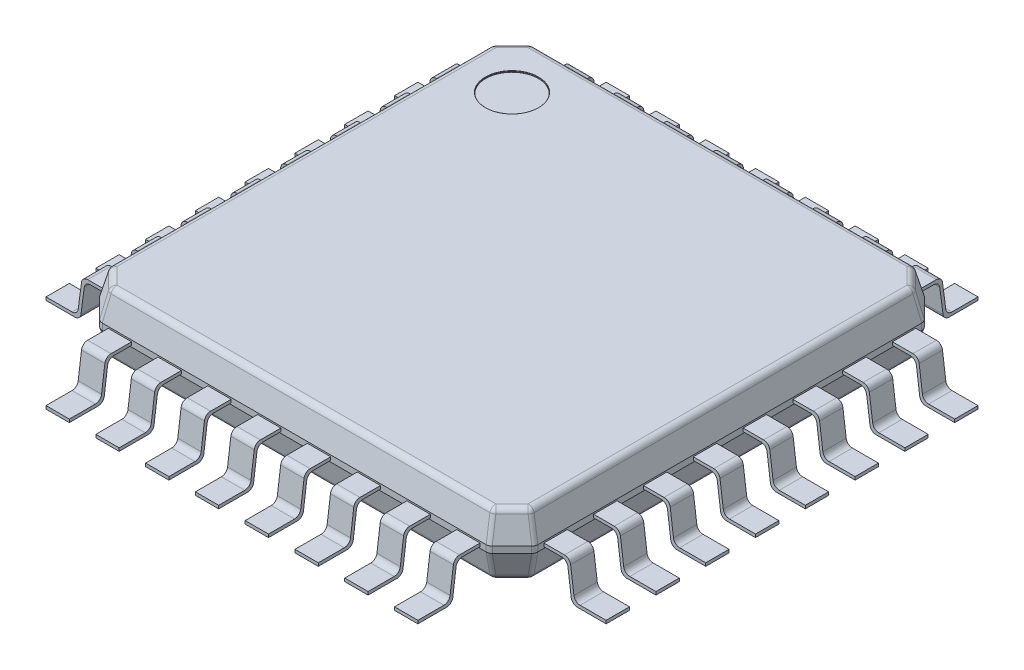
from build123d import *
from OCP.BRepFilletAPI import BRepFilletAPI_MakeChamfer

# Parameters (mm, degrees)
BOSS_EXTRUDE1_START  = 0.1
SKETCH1_W            = 7
SKETCH1_H            = 7
BOSS_EXTRUDE1_DEPTH  = 1
BOSS_EXTRUDE2_START  = -0.5125
BOSS_EXTRUDE2_DEPTH  = 0.375
LPATTERN1_COUNT      = 8
LPATTERN1_PITCH      = 0.8
CIRPATTERN2_START    = -2.9875
CIRPATTERN2_DEPTH    = 0.375
CIRPATTERN2_START_2  = -2.1875
CIRPATTERN2_2_DEPTH  = 0.375
CIRPATTERN2_START_3  = -1.3875
CIRPATTERN2_3_DEPTH  = 0.375
CIRPATTERN2_START_4  = -0.5875
CIRPATTERN2_4_DEPTH  = 0.375
CIRPATTERN2_START_5  = 0.2125
CIRPATTERN2_5_DEPTH  = 0.375
CIRPATTERN2_START_6  = 1.0125
CIRPATTERN2_6_DEPTH  = 0.375
CIRPATTERN2_START_7  = 1.8125
CIRPATTERN2_7_DEPTH  = 0.375
CIRPATTERN2_START_8  = 2.6125
CIRPATTERN2_8_DEPTH  = 0.375
CIRPATTERN2_9_DEPTH  = 0.375
CIRPATTERN2_10_DEPTH = 0.375
CIRPATTERN2_11_DEPTH = 0.375
CIRPATTERN2_12_DEPTH = 0.375
CIRPATTERN2_13_DEPTH = 0.375
CIRPATTERN2_14_DEPTH = 0.375
CIRPATTERN2_15_DEPTH = 0.375
CIRPATTERN2_16_DEPTH = 0.375
CHAMFER1_SIZE        = 0.375
CHAMFER2_SIZE        = 0.45
CHAMFER2_SIZE2       = 0.120577137
CHAMFER3_SIZE        = 0.45
CHAMFER3_SIZE2       = 0.120577137
FILLET1_R            = 0.1
SKETCH3_R            = 0.425
CUT_EXTRUDE1_DEPTH   = 0.02
FILLET2_R            = 0.0025


# Read off the part's stored shape, not the designer's step: CirPattern2
with BuildPart() as part:
    # Sketch1 → Boss-Extrude1 (new body)
    with BuildSketch(Plane(origin=(0, 0, 0), x_dir=(1, 0, 0), z_dir=(0, 1, 0)).offset(BOSS_EXTRUDE1_START)):
        Rectangle(SKETCH1_W, SKETCH1_H)
    extrude(amount=BOSS_EXTRUDE1_DEPTH)

    # Sketch2 → Boss-Extrude2 (add)
    with BuildSketch(Plane(origin=(3.5, 0, 0), x_dir=(0, 0, -1), z_dir=(1, 0, 0)).offset(BOSS_EXTRUDE2_START)):
        with BuildLine():
            Line((-4.5, 0), (-4.037697646, 0))
            ThreePointArc((-4.037697646, 0), (-3.971763065, 0.024816019), (-3.93855316, 0.086947381))
            Line((-3.93855316, 0.086947381), (-3.885746654, 0.488052619))
            ThreePointArc((-3.885746654, 0.488052619), (-3.852536749, 0.550183981), (-3.786602168, 0.575))
            Line((-3.786602168, 0.575), (-3.5, 0.575))
            Line((-3.5, 0.575), (-3.5, 0.625))
            Line((-3.5, 0.625), (-3.830450991, 0.625))
            ThreePointArc((-3.830450991, 0.625), (-3.896385572, 0.600183981), (-3.929595477, 0.538052619))
            Line((-3.929595477, 0.538052619), (-3.982401983, 0.136947381))
            ThreePointArc((-3.982401983, 0.136947381), (-4.015611888, 0.074816019), (-4.081546469, 0.05))
            Line((-4.081546469, 0.05), (-4.5, 0.05))
            Line((-4.5, 0.05), (-4.5, 0))
        make_face()
    boss_extrude2 = extrude(amount=-BOSS_EXTRUDE2_DEPTH)

    # LPattern1: Boss-Extrude2 ×8
    with Locations(*[(-i * LPATTERN1_PITCH, 0, 0) for i in range(1, LPATTERN1_COUNT)]):
        add(boss_extrude2)

    # CirPattern2 outline → CirPattern2 (add)
    with BuildSketch(Plane.XY.offset(CIRPATTERN2_START)):
        with BuildLine():
            Line((4.5, 0), (4.5, 0.05))
            Line((4.5, 0.05), (4.081546469, 0.05))
            ThreePointArc((4.081546469, 0.05), (4.015611888, 0.074816019), (3.982401983, 0.136947381))
            Line((3.982401983, 0.136947381), (3.929595477, 0.538052619))
            ThreePointArc((3.929595477, 0.538052619), (3.896385572, 0.600183981), (3.830450991, 0.625))
            Line((3.830450991, 0.625), (3.5, 0.625))
            Line((3.5, 0.625), (3.5, 0.575))
            Line((3.5, 0.575), (3.786602168, 0.575))
            ThreePointArc((3.786602168, 0.575), (3.852536749, 0.550183981), (3.885746654, 0.488052619))
            Line((3.885746654, 0.488052619), (3.93855316, 0.086947381))
            ThreePointArc((3.93855316, 0.086947381), (3.971763065, 0.024816019), (4.037697646, 0))
            Line((4.037697646, 0), (4.5, 0))
        make_face()
        with BuildLine():
            ThreePointArc((-3.982401983, 0.136947381), (-4.015611888, 0.074816019), (-4.081546469, 0.05))
            Line((-4.081546469, 0.05), (-4.5, 0.05))
            Line((-4.5, 0.05), (-4.5, 0))
            Line((-4.5, 0), (-4.037697646, 0))
            ThreePointArc((-4.037697646, 0), (-3.971763065, 0.024816019), (-3.93855316, 0.086947381))
            Line((-3.93855316, 0.086947381), (-3.885746654, 0.488052619))
            ThreePointArc((-3.885746654, 0.488052619), (-3.852536749, 0.550183981), (-3.786602168, 0.575))
            Line((-3.786602168, 0.575), (-3.5, 0.575))
            Line((-3.5, 0.575), (-3.5, 0.625))
            Line((-3.5, 0.625), (-3.830450991, 0.625))
            ThreePointArc((-3.830450991, 0.625), (-3.896385572, 0.600183981), (-3.929595477, 0.538052619))
            Line((-3.929595477, 0.538052619), (-3.982401983, 0.136947381))
        make_face()
    extrude(amount=CIRPATTERN2_DEPTH)

    # CirPattern2 2 outline → CirPattern2 2 (add)
    with BuildSketch(Plane.XY.offset(CIRPATTERN2_START_2)):
        with BuildLine():
            Line((4.5, 0), (4.5, 0.05))
            Line((4.5, 0.05), (4.081546469, 0.05))
            ThreePointArc((4.081546469, 0.05), (4.015611888, 0.074816019), (3.982401983, 0.136947381))
            Line((3.982401983, 0.136947381), (3.929595477, 0.538052619))
            ThreePointArc((3.929595477, 0.538052619), (3.896385572, 0.600183981), (3.830450991, 0.625))
            Line((3.830450991, 0.625), (3.5, 0.625))
            Line((3.5, 0.625), (3.5, 0.575))
            Line((3.5, 0.575), (3.786602168, 0.575))
            ThreePointArc((3.786602168, 0.575), (3.852536749, 0.550183981), (3.885746654, 0.488052619))
            Line((3.885746654, 0.488052619), (3.93855316, 0.086947381))
            ThreePointArc((3.93855316, 0.086947381), (3.971763065, 0.024816019), (4.037697646, 0))
            Line((4.037697646, 0), (4.5, 0))
        make_face()
        with BuildLine():
            ThreePointArc((-3.982401983, 0.136947381), (-4.015611888, 0.074816019), (-4.081546469, 0.05))
            Line((-4.081546469, 0.05), (-4.5, 0.05))
            Line((-4.5, 0.05), (-4.5, 0))
            Line((-4.5, 0), (-4.037697646, 0))
            ThreePointArc((-4.037697646, 0), (-3.971763065, 0.024816019), (-3.93855316, 0.086947381))
            Line((-3.93855316, 0.086947381), (-3.885746654, 0.488052619))
            ThreePointArc((-3.885746654, 0.488052619), (-3.852536749, 0.550183981), (-3.786602168, 0.575))
            Line((-3.786602168, 0.575), (-3.5, 0.575))
            Line((-3.5, 0.575), (-3.5, 0.625))
            Line((-3.5, 0.625), (-3.830450991, 0.625))
            ThreePointArc((-3.830450991, 0.625), (-3.896385572, 0.600183981), (-3.929595477, 0.538052619))
            Line((-3.929595477, 0.538052619), (-3.982401983, 0.136947381))
        make_face()
    extrude(amount=CIRPATTERN2_2_DEPTH)

    # CirPattern2 3 outline → CirPattern2 3 (add)
    with BuildSketch(Plane.XY.offset(CIRPATTERN2_START_3)):
        with BuildLine():
            Line((4.5, 0), (4.5, 0.05))
            Line((4.5, 0.05), (4.081546469, 0.05))
            ThreePointArc((4.081546469, 0.05), (4.015611888, 0.074816019), (3.982401983, 0.136947381))
            Line((3.982401983, 0.136947381), (3.929595477, 0.538052619))
            ThreePointArc((3.929595477, 0.538052619), (3.896385572, 0.600183981), (3.830450991, 0.625))
            Line((3.830450991, 0.625), (3.5, 0.625))
            Line((3.5, 0.625), (3.5, 0.575))
            Line((3.5, 0.575), (3.786602168, 0.575))
            ThreePointArc((3.786602168, 0.575), (3.852536749, 0.550183981), (3.885746654, 0.488052619))
            Line((3.885746654, 0.488052619), (3.93855316, 0.086947381))
            ThreePointArc((3.93855316, 0.086947381), (3.971763065, 0.024816019), (4.037697646, 0))
            Line((4.037697646, 0), (4.5, 0))
        make_face()
        with BuildLine():
            ThreePointArc((-3.982401983, 0.136947381), (-4.015611888, 0.074816019), (-4.081546469, 0.05))
            Line((-4.081546469, 0.05), (-4.5, 0.05))
            Line((-4.5, 0.05), (-4.5, 0))
            Line((-4.5, 0), (-4.037697646, 0))
            ThreePointArc((-4.037697646, 0), (-3.971763065, 0.024816019), (-3.93855316, 0.086947381))
            Line((-3.93855316, 0.086947381), (-3.885746654, 0.488052619))
            ThreePointArc((-3.885746654, 0.488052619), (-3.852536749, 0.550183981), (-3.786602168, 0.575))
            Line((-3.786602168, 0.575), (-3.5, 0.575))
            Line((-3.5, 0.575), (-3.5, 0.625))
            Line((-3.5, 0.625), (-3.830450991, 0.625))
            ThreePointArc((-3.830450991, 0.625), (-3.896385572, 0.600183981), (-3.929595477, 0.538052619))
            Line((-3.929595477, 0.538052619), (-3.982401983, 0.136947381))
        make_face()
    extrude(amount=CIRPATTERN2_3_DEPTH)

    # CirPattern2 4 outline → CirPattern2 4 (add)
    with BuildSketch(Plane.XY.offset(CIRPATTERN2_START_4)):
        with BuildLine():
            Line((4.5, 0), (4.5, 0.05))
            Line((4.5, 0.05), (4.081546469, 0.05))
            ThreePointArc((4.081546469, 0.05), (4.015611888, 0.074816019), (3.982401983, 0.136947381))
            Line((3.982401983, 0.136947381), (3.929595477, 0.538052619))
            ThreePointArc((3.929595477, 0.538052619), (3.896385572, 0.600183981), (3.830450991, 0.625))
            Line((3.830450991, 0.625), (3.5, 0.625))
            Line((3.5, 0.625), (3.5, 0.575))
            Line((3.5, 0.575), (3.786602168, 0.575))
            ThreePointArc((3.786602168, 0.575), (3.852536749, 0.550183981), (3.885746654, 0.488052619))
            Line((3.885746654, 0.488052619), (3.93855316, 0.086947381))
            ThreePointArc((3.93855316, 0.086947381), (3.971763065, 0.024816019), (4.037697646, 0))
            Line((4.037697646, 0), (4.5, 0))
        make_face()
        with BuildLine():
            ThreePointArc((-3.982401983, 0.136947381), (-4.015611888, 0.074816019), (-4.081546469, 0.05))
            Line((-4.081546469, 0.05), (-4.5, 0.05))
            Line((-4.5, 0.05), (-4.5, 0))
            Line((-4.5, 0), (-4.037697646, 0))
            ThreePointArc((-4.037697646, 0), (-3.971763065, 0.024816019), (-3.93855316, 0.086947381))
            Line((-3.93855316, 0.086947381), (-3.885746654, 0.488052619))
            ThreePointArc((-3.885746654, 0.488052619), (-3.852536749, 0.550183981), (-3.786602168, 0.575))
            Line((-3.786602168, 0.575), (-3.5, 0.575))
            Line((-3.5, 0.575), (-3.5, 0.625))
            Line((-3.5, 0.625), (-3.830450991, 0.625))
            ThreePointArc((-3.830450991, 0.625), (-3.896385572, 0.600183981), (-3.929595477, 0.538052619))
            Line((-3.929595477, 0.538052619), (-3.982401983, 0.136947381))
        make_face()
    extrude(amount=CIRPATTERN2_4_DEPTH)

    # CirPattern2 5 outline → CirPattern2 5 (add)
    with BuildSketch(Plane.XY.offset(CIRPATTERN2_START_5)):
        with BuildLine():
            Line((4.5, 0), (4.5, 0.05))
            Line((4.5, 0.05), (4.081546469, 0.05))
            ThreePointArc((4.081546469, 0.05), (4.015611888, 0.074816019), (3.982401983, 0.136947381))
            Line((3.982401983, 0.136947381), (3.929595477, 0.538052619))
            ThreePointArc((3.929595477, 0.538052619), (3.896385572, 0.600183981), (3.830450991, 0.625))
            Line((3.830450991, 0.625), (3.5, 0.625))
            Line((3.5, 0.625), (3.5, 0.575))
            Line((3.5, 0.575), (3.786602168, 0.575))
            ThreePointArc((3.786602168, 0.575), (3.852536749, 0.550183981), (3.885746654, 0.488052619))
            Line((3.885746654, 0.488052619), (3.93855316, 0.086947381))
            ThreePointArc((3.93855316, 0.086947381), (3.971763065, 0.024816019), (4.037697646, 0))
            Line((4.037697646, 0), (4.5, 0))
        make_face()
        with BuildLine():
            ThreePointArc((-3.982401983, 0.136947381), (-4.015611888, 0.074816019), (-4.081546469, 0.05))
            Line((-4.081546469, 0.05), (-4.5, 0.05))
            Line((-4.5, 0.05), (-4.5, 0))
            Line((-4.5, 0), (-4.037697646, 0))
            ThreePointArc((-4.037697646, 0), (-3.971763065, 0.024816019), (-3.93855316, 0.086947381))
            Line((-3.93855316, 0.086947381), (-3.885746654, 0.488052619))
            ThreePointArc((-3.885746654, 0.488052619), (-3.852536749, 0.550183981), (-3.786602168, 0.575))
            Line((-3.786602168, 0.575), (-3.5, 0.575))
            Line((-3.5, 0.575), (-3.5, 0.625))
            Line((-3.5, 0.625), (-3.830450991, 0.625))
            ThreePointArc((-3.830450991, 0.625), (-3.896385572, 0.600183981), (-3.929595477, 0.538052619))
            Line((-3.929595477, 0.538052619), (-3.982401983, 0.136947381))
        make_face()
    extrude(amount=CIRPATTERN2_5_DEPTH)

    # CirPattern2 6 outline → CirPattern2 6 (add)
    with BuildSketch(Plane.XY.offset(CIRPATTERN2_START_6)):
        with BuildLine():
            Line((4.5, 0), (4.5, 0.05))
            Line((4.5, 0.05), (4.081546469, 0.05))
            ThreePointArc((4.081546469, 0.05), (4.015611888, 0.074816019), (3.982401983, 0.136947381))
            Line((3.982401983, 0.136947381), (3.929595477, 0.538052619))
            ThreePointArc((3.929595477, 0.538052619), (3.896385572, 0.600183981), (3.830450991, 0.625))
            Line((3.830450991, 0.625), (3.5, 0.625))
            Line((3.5, 0.625), (3.5, 0.575))
            Line((3.5, 0.575), (3.786602168, 0.575))
            ThreePointArc((3.786602168, 0.575), (3.852536749, 0.550183981), (3.885746654, 0.488052619))
            Line((3.885746654, 0.488052619), (3.93855316, 0.086947381))
            ThreePointArc((3.93855316, 0.086947381), (3.971763065, 0.024816019), (4.037697646, 0))
            Line((4.037697646, 0), (4.5, 0))
        make_face()
        with BuildLine():
            ThreePointArc((-3.982401983, 0.136947381), (-4.015611888, 0.074816019), (-4.081546469, 0.05))
            Line((-4.081546469, 0.05), (-4.5, 0.05))
            Line((-4.5, 0.05), (-4.5, 0))
            Line((-4.5, 0), (-4.037697646, 0))
            ThreePointArc((-4.037697646, 0), (-3.971763065, 0.024816019), (-3.93855316, 0.086947381))
            Line((-3.93855316, 0.086947381), (-3.885746654, 0.488052619))
            ThreePointArc((-3.885746654, 0.488052619), (-3.852536749, 0.550183981), (-3.786602168, 0.575))
            Line((-3.786602168, 0.575), (-3.5, 0.575))
            Line((-3.5, 0.575), (-3.5, 0.625))
            Line((-3.5, 0.625), (-3.830450991, 0.625))
            ThreePointArc((-3.830450991, 0.625), (-3.896385572, 0.600183981), (-3.929595477, 0.538052619))
            Line((-3.929595477, 0.538052619), (-3.982401983, 0.136947381))
        make_face()
    extrude(amount=CIRPATTERN2_6_DEPTH)

    # CirPattern2 7 outline → CirPattern2 7 (add)
    with BuildSketch(Plane.XY.offset(CIRPATTERN2_START_7)):
        with BuildLine():
            Line((4.5, 0), (4.5, 0.05))
            Line((4.5, 0.05), (4.081546469, 0.05))
            ThreePointArc((4.081546469, 0.05), (4.015611888, 0.074816019), (3.982401983, 0.136947381))
            Line((3.982401983, 0.136947381), (3.929595477, 0.538052619))
            ThreePointArc((3.929595477, 0.538052619), (3.896385572, 0.600183981), (3.830450991, 0.625))
            Line((3.830450991, 0.625), (3.5, 0.625))
            Line((3.5, 0.625), (3.5, 0.575))
            Line((3.5, 0.575), (3.786602168, 0.575))
            ThreePointArc((3.786602168, 0.575), (3.852536749, 0.550183981), (3.885746654, 0.488052619))
            Line((3.885746654, 0.488052619), (3.93855316, 0.086947381))
            ThreePointArc((3.93855316, 0.086947381), (3.971763065, 0.024816019), (4.037697646, 0))
            Line((4.037697646, 0), (4.5, 0))
        make_face()
        with BuildLine():
            ThreePointArc((-3.982401983, 0.136947381), (-4.015611888, 0.074816019), (-4.081546469, 0.05))
            Line((-4.081546469, 0.05), (-4.5, 0.05))
            Line((-4.5, 0.05), (-4.5, 0))
            Line((-4.5, 0), (-4.037697646, 0))
            ThreePointArc((-4.037697646, 0), (-3.971763065, 0.024816019), (-3.93855316, 0.086947381))
            Line((-3.93855316, 0.086947381), (-3.885746654, 0.488052619))
            ThreePointArc((-3.885746654, 0.488052619), (-3.852536749, 0.550183981), (-3.786602168, 0.575))
            Line((-3.786602168, 0.575), (-3.5, 0.575))
            Line((-3.5, 0.575), (-3.5, 0.625))
            Line((-3.5, 0.625), (-3.830450991, 0.625))
            ThreePointArc((-3.830450991, 0.625), (-3.896385572, 0.600183981), (-3.929595477, 0.538052619))
            Line((-3.929595477, 0.538052619), (-3.982401983, 0.136947381))
        make_face()
    extrude(amount=CIRPATTERN2_7_DEPTH)

    # CirPattern2 8 outline → CirPattern2 8 (add)
    with BuildSketch(Plane.XY.offset(CIRPATTERN2_START_8)):
        with BuildLine():
            Line((4.5, 0), (4.5, 0.05))
            Line((4.5, 0.05), (4.081546469, 0.05))
            ThreePointArc((4.081546469, 0.05), (4.015611888, 0.074816019), (3.982401983, 0.136947381))
            Line((3.982401983, 0.136947381), (3.929595477, 0.538052619))
            ThreePointArc((3.929595477, 0.538052619), (3.896385572, 0.600183981), (3.830450991, 0.625))
            Line((3.830450991, 0.625), (3.5, 0.625))
            Line((3.5, 0.625), (3.5, 0.575))
            Line((3.5, 0.575), (3.786602168, 0.575))
            ThreePointArc((3.786602168, 0.575), (3.852536749, 0.550183981), (3.885746654, 0.488052619))
            Line((3.885746654, 0.488052619), (3.93855316, 0.086947381))
            ThreePointArc((3.93855316, 0.086947381), (3.971763065, 0.024816019), (4.037697646, 0))
            Line((4.037697646, 0), (4.5, 0))
        make_face()
        with BuildLine():
            ThreePointArc((-3.982401983, 0.136947381), (-4.015611888, 0.074816019), (-4.081546469, 0.05))
            Line((-4.081546469, 0.05), (-4.5, 0.05))
            Line((-4.5, 0.05), (-4.5, 0))
            Line((-4.5, 0), (-4.037697646, 0))
            ThreePointArc((-4.037697646, 0), (-3.971763065, 0.024816019), (-3.93855316, 0.086947381))
            Line((-3.93855316, 0.086947381), (-3.885746654, 0.488052619))
            ThreePointArc((-3.885746654, 0.488052619), (-3.852536749, 0.550183981), (-3.786602168, 0.575))
            Line((-3.786602168, 0.575), (-3.5, 0.575))
            Line((-3.5, 0.575), (-3.5, 0.625))
            Line((-3.5, 0.625), (-3.830450991, 0.625))
            ThreePointArc((-3.830450991, 0.625), (-3.896385572, 0.600183981), (-3.929595477, 0.538052619))
            Line((-3.929595477, 0.538052619), (-3.982401983, 0.136947381))
        make_face()
    extrude(amount=CIRPATTERN2_8_DEPTH)

    # CirPattern2 9 outline → CirPattern2 9 (add)
    with BuildSketch(Plane.YZ.offset(CIRPATTERN2_START)):
        with BuildLine():
            Line((0, -4.5), (0.05, -4.5))
            Line((0.05, -4.5), (0.05, -4.081546469))
            ThreePointArc((0.05, -4.081546469), (0.074816019, -4.015611888), (0.136947381, -3.982401983))
            Line((0.136947381, -3.982401983), (0.538052619, -3.929595477))
            ThreePointArc((0.538052619, -3.929595477), (0.600183981, -3.896385572), (0.625, -3.830450991))
            Line((0.625, -3.830450991), (0.625, -3.5))
            Line((0.625, -3.5), (0.575, -3.5))
            Line((0.575, -3.5), (0.575, -3.786602168))
            ThreePointArc((0.575, -3.786602168), (0.550183981, -3.852536749), (0.488052619, -3.885746654))
            Line((0.488052619, -3.885746654), (0.086947381, -3.93855316))
            ThreePointArc((0.086947381, -3.93855316), (0.024816019, -3.971763065), (0, -4.037697646))
            Line((0, -4.037697646), (0, -4.5))
        make_face()
    extrude(amount=CIRPATTERN2_9_DEPTH)

    # CirPattern2 10 outline → CirPattern2 10 (add)
    with BuildSketch(Plane.YZ.offset(CIRPATTERN2_START_2)):
        with BuildLine():
            Line((0, -4.5), (0.05, -4.5))
            Line((0.05, -4.5), (0.05, -4.081546469))
            ThreePointArc((0.05, -4.081546469), (0.074816019, -4.015611888), (0.136947381, -3.982401983))
            Line((0.136947381, -3.982401983), (0.538052619, -3.929595477))
            ThreePointArc((0.538052619, -3.929595477), (0.600183981, -3.896385572), (0.625, -3.830450991))
            Line((0.625, -3.830450991), (0.625, -3.5))
            Line((0.625, -3.5), (0.575, -3.5))
            Line((0.575, -3.5), (0.575, -3.786602168))
            ThreePointArc((0.575, -3.786602168), (0.550183981, -3.852536749), (0.488052619, -3.885746654))
            Line((0.488052619, -3.885746654), (0.086947381, -3.93855316))
            ThreePointArc((0.086947381, -3.93855316), (0.024816019, -3.971763065), (0, -4.037697646))
            Line((0, -4.037697646), (0, -4.5))
        make_face()
    extrude(amount=CIRPATTERN2_10_DEPTH)

    # CirPattern2 11 outline → CirPattern2 11 (add)
    with BuildSketch(Plane.YZ.offset(CIRPATTERN2_START_3)):
        with BuildLine():
            Line((0, -4.5), (0.05, -4.5))
            Line((0.05, -4.5), (0.05, -4.081546469))
            ThreePointArc((0.05, -4.081546469), (0.074816019, -4.015611888), (0.136947381, -3.982401983))
            Line((0.136947381, -3.982401983), (0.538052619, -3.929595477))
            ThreePointArc((0.538052619, -3.929595477), (0.600183981, -3.896385572), (0.625, -3.830450991))
            Line((0.625, -3.830450991), (0.625, -3.5))
            Line((0.625, -3.5), (0.575, -3.5))
            Line((0.575, -3.5), (0.575, -3.786602168))
            ThreePointArc((0.575, -3.786602168), (0.550183981, -3.852536749), (0.488052619, -3.885746654))
            Line((0.488052619, -3.885746654), (0.086947381, -3.93855316))
            ThreePointArc((0.086947381, -3.93855316), (0.024816019, -3.971763065), (0, -4.037697646))
            Line((0, -4.037697646), (0, -4.5))
        make_face()
    extrude(amount=CIRPATTERN2_11_DEPTH)

    # CirPattern2 12 outline → CirPattern2 12 (add)
    with BuildSketch(Plane.YZ.offset(CIRPATTERN2_START_4)):
        with BuildLine():
            Line((0, -4.5), (0.05, -4.5))
            Line((0.05, -4.5), (0.05, -4.081546469))
            ThreePointArc((0.05, -4.081546469), (0.074816019, -4.015611888), (0.136947381, -3.982401983))
            Line((0.136947381, -3.982401983), (0.538052619, -3.929595477))
            ThreePointArc((0.538052619, -3.929595477), (0.600183981, -3.896385572), (0.625, -3.830450991))
            Line((0.625, -3.830450991), (0.625, -3.5))
            Line((0.625, -3.5), (0.575, -3.5))
            Line((0.575, -3.5), (0.575, -3.786602168))
            ThreePointArc((0.575, -3.786602168), (0.550183981, -3.852536749), (0.488052619, -3.885746654))
            Line((0.488052619, -3.885746654), (0.086947381, -3.93855316))
            ThreePointArc((0.086947381, -3.93855316), (0.024816019, -3.971763065), (0, -4.037697646))
            Line((0, -4.037697646), (0, -4.5))
        make_face()
    extrude(amount=CIRPATTERN2_12_DEPTH)

    # CirPattern2 13 outline → CirPattern2 13 (add)
    with BuildSketch(Plane.YZ.offset(CIRPATTERN2_START_5)):
        with BuildLine():
            Line((0, -4.5), (0.05, -4.5))
            Line((0.05, -4.5), (0.05, -4.081546469))
            ThreePointArc((0.05, -4.081546469), (0.074816019, -4.015611888), (0.136947381, -3.982401983))
            Line((0.136947381, -3.982401983), (0.538052619, -3.929595477))
            ThreePointArc((0.538052619, -3.929595477), (0.600183981, -3.896385572), (0.625, -3.830450991))
            Line((0.625, -3.830450991), (0.625, -3.5))
            Line((0.625, -3.5), (0.575, -3.5))
            Line((0.575, -3.5), (0.575, -3.786602168))
            ThreePointArc((0.575, -3.786602168), (0.550183981, -3.852536749), (0.488052619, -3.885746654))
            Line((0.488052619, -3.885746654), (0.086947381, -3.93855316))
            ThreePointArc((0.086947381, -3.93855316), (0.024816019, -3.971763065), (0, -4.037697646))
            Line((0, -4.037697646), (0, -4.5))
        make_face()
    extrude(amount=CIRPATTERN2_13_DEPTH)

    # CirPattern2 14 outline → CirPattern2 14 (add)
    with BuildSketch(Plane.YZ.offset(CIRPATTERN2_START_6)):
        with BuildLine():
            Line((0, -4.5), (0.05, -4.5))
            Line((0.05, -4.5), (0.05, -4.081546469))
            ThreePointArc((0.05, -4.081546469), (0.074816019, -4.015611888), (0.136947381, -3.982401983))
            Line((0.136947381, -3.982401983), (0.538052619, -3.929595477))
            ThreePointArc((0.538052619, -3.929595477), (0.600183981, -3.896385572), (0.625, -3.830450991))
            Line((0.625, -3.830450991), (0.625, -3.5))
            Line((0.625, -3.5), (0.575, -3.5))
            Line((0.575, -3.5), (0.575, -3.786602168))
            ThreePointArc((0.575, -3.786602168), (0.550183981, -3.852536749), (0.488052619, -3.885746654))
            Line((0.488052619, -3.885746654), (0.086947381, -3.93855316))
            ThreePointArc((0.086947381, -3.93855316), (0.024816019, -3.971763065), (0, -4.037697646))
            Line((0, -4.037697646), (0, -4.5))
        make_face()
    extrude(amount=CIRPATTERN2_14_DEPTH)

    # CirPattern2 15 outline → CirPattern2 15 (add)
    with BuildSketch(Plane.YZ.offset(CIRPATTERN2_START_7)):
        with BuildLine():
            Line((0, -4.5), (0.05, -4.5))
            Line((0.05, -4.5), (0.05, -4.081546469))
            ThreePointArc((0.05, -4.081546469), (0.074816019, -4.015611888), (0.136947381, -3.982401983))
            Line((0.136947381, -3.982401983), (0.538052619, -3.929595477))
            ThreePointArc((0.538052619, -3.929595477), (0.600183981, -3.896385572), (0.625, -3.830450991))
            Line((0.625, -3.830450991), (0.625, -3.5))
            Line((0.625, -3.5), (0.575, -3.5))
            Line((0.575, -3.5), (0.575, -3.786602168))
            ThreePointArc((0.575, -3.786602168), (0.550183981, -3.852536749), (0.488052619, -3.885746654))
            Line((0.488052619, -3.885746654), (0.086947381, -3.93855316))
            ThreePointArc((0.086947381, -3.93855316), (0.024816019, -3.971763065), (0, -4.037697646))
            Line((0, -4.037697646), (0, -4.5))
        make_face()
    extrude(amount=CIRPATTERN2_15_DEPTH)

    # CirPattern2 16 outline → CirPattern2 16 (add)
    with BuildSketch(Plane.YZ.offset(CIRPATTERN2_START_8)):
        with BuildLine():
            Line((0, -4.5), (0.05, -4.5))
            Line((0.05, -4.5), (0.05, -4.081546469))
            ThreePointArc((0.05, -4.081546469), (0.074816019, -4.015611888), (0.136947381, -3.982401983))
            Line((0.136947381, -3.982401983), (0.538052619, -3.929595477))
            ThreePointArc((0.538052619, -3.929595477), (0.600183981, -3.896385572), (0.625, -3.830450991))
            Line((0.625, -3.830450991), (0.625, -3.5))
            Line((0.625, -3.5), (0.575, -3.5))
            Line((0.575, -3.5), (0.575, -3.786602168))
            ThreePointArc((0.575, -3.786602168), (0.550183981, -3.852536749), (0.488052619, -3.885746654))
            Line((0.488052619, -3.885746654), (0.086947381, -3.93855316))
            ThreePointArc((0.086947381, -3.93855316), (0.024816019, -3.971763065), (0, -4.037697646))
            Line((0, -4.037697646), (0, -4.5))
        make_face()
    extrude(amount=CIRPATTERN2_16_DEPTH)

    # Chamfer1
    chamfer1_edges = [part.edges().sort_by_distance(p)[0] for p in [
        (-3.5, 0.6, -3.5),
        (3.5, 0.6, -3.5),
        (3.5, 0.6, 3.5),
        (-3.5, 0.6, 3.5),
    ]]
    chamfer(chamfer1_edges, length=CHAMFER1_SIZE)

    # Chamfer2: one chamfer whose edges measure the first distance from different faces: ONE call of the kernel's chamfer builder (chamfer() names one face for all edges)
    chamfer2_edges_1 = [part.edges().sort_by_distance(p)[0] for p in [
        (-3.5, 1.1, 0),
    ]]
    chamfer2_side_1 = [part.faces().sort_by_distance(p)[0] for p in [
        (-3.5, 0.6, 0),
    ]]
    chamfer2_edges_2 = [part.edges().sort_by_distance(p)[0] for p in [
        (0, 1.1, -3.5),
    ]]
    chamfer2_side_2 = [part.faces().sort_by_distance(p)[0] for p in [
        (0, 0.6, -3.5),
    ]]
    chamfer2_edges_3 = [part.edges().sort_by_distance(p)[0] for p in [
        (0, 1.1, 3.5),
    ]]
    chamfer2_side_3 = [part.faces().sort_by_distance(p)[0] for p in [
        (0, 0.6, 3.5),
    ]]
    chamfer2_edges_4 = [part.edges().sort_by_distance(p)[0] for p in [
        (3.5, 1.1, 0),
    ]]
    chamfer2_side_4 = [part.faces().sort_by_distance(p)[0] for p in [
        (3.5, 0.6, 0),
    ]]
    chamfer2_edges_5 = [part.edges().sort_by_distance(p)[0] for p in [
        (-3.3125, 1.1, 3.3125),
    ]]
    chamfer2_side_5 = [part.faces().sort_by_distance(p)[0] for p in [
        (-3.3125, 0.6, 3.3125),
    ]]
    chamfer2_edges_6 = [part.edges().sort_by_distance(p)[0] for p in [
        (3.3125, 1.1, 3.3125),
    ]]
    chamfer2_side_6 = [part.faces().sort_by_distance(p)[0] for p in [
        (3.3125, 0.6, 3.3125),
    ]]
    chamfer2_edges_7 = [part.edges().sort_by_distance(p)[0] for p in [
        (3.3125, 1.1, -3.3125),
    ]]
    chamfer2_side_7 = [part.faces().sort_by_distance(p)[0] for p in [
        (3.3125, 0.6, -3.3125),
    ]]
    chamfer2_edges_8 = [part.edges().sort_by_distance(p)[0] for p in [
        (-3.3125, 1.1, -3.3125),
    ]]
    chamfer2_side_8 = [part.faces().sort_by_distance(p)[0] for p in [
        (-3.3125, 0.6, -3.3125),
    ]]
    chamfer2 = BRepFilletAPI_MakeChamfer(part.part.solid().wrapped)
    for e in chamfer2_edges_1:
        chamfer2.Add(CHAMFER2_SIZE, CHAMFER2_SIZE2, e.wrapped, chamfer2_side_1[0].wrapped)  # the first distance lies on this face
    for e in chamfer2_edges_2:
        chamfer2.Add(CHAMFER2_SIZE, CHAMFER2_SIZE2, e.wrapped, chamfer2_side_2[0].wrapped)  # the first distance lies on this face
    for e in chamfer2_edges_3:
        chamfer2.Add(CHAMFER2_SIZE, CHAMFER2_SIZE2, e.wrapped, chamfer2_side_3[0].wrapped)  # the first distance lies on this face
    for e in chamfer2_edges_4:
        chamfer2.Add(CHAMFER2_SIZE, CHAMFER2_SIZE2, e.wrapped, chamfer2_side_4[0].wrapped)  # the first distance lies on this face
    for e in chamfer2_edges_5:
        chamfer2.Add(CHAMFER2_SIZE, CHAMFER2_SIZE2, e.wrapped, chamfer2_side_5[0].wrapped)  # the first distance lies on this face
    for e in chamfer2_edges_6:
        chamfer2.Add(CHAMFER2_SIZE, CHAMFER2_SIZE2, e.wrapped, chamfer2_side_6[0].wrapped)  # the first distance lies on this face
    for e in chamfer2_edges_7:
        chamfer2.Add(CHAMFER2_SIZE, CHAMFER2_SIZE2, e.wrapped, chamfer2_side_7[0].wrapped)  # the first distance lies on this face
    for e in chamfer2_edges_8:
        chamfer2.Add(CHAMFER2_SIZE, CHAMFER2_SIZE2, e.wrapped, chamfer2_side_8[0].wrapped)  # the first distance lies on this face
    add(Compound.cast(chamfer2.Shape()), mode=Mode.REPLACE)

    # Chamfer3: one chamfer whose edges measure the first distance from different faces: ONE call of the kernel's chamfer builder (chamfer() names one face for all edges)
    chamfer3_edges_1 = [part.edges().sort_by_distance(p)[0] for p in [
        (-3.5, 0.1, 0),
    ]]
    chamfer3_side_1 = [part.faces().sort_by_distance(p)[0] for p in [
        (-3.5, 0.36473384, 0),
    ]]
    chamfer3_edges_2 = [part.edges().sort_by_distance(p)[0] for p in [
        (0, 0.1, -3.5),
    ]]
    chamfer3_side_2 = [part.faces().sort_by_distance(p)[0] for p in [
        (0, 0.36473384, -3.5),
    ]]
    chamfer3_edges_3 = [part.edges().sort_by_distance(p)[0] for p in [
        (3.5, 0.1, 0),
    ]]
    chamfer3_side_3 = [part.faces().sort_by_distance(p)[0] for p in [
        (3.5, 0.36473384, 0),
    ]]
    chamfer3_edges_4 = [part.edges().sort_by_distance(p)[0] for p in [
        (0, 0.1, 3.5),
    ]]
    chamfer3_side_4 = [part.faces().sort_by_distance(p)[0] for p in [
        (0, 0.36473384, 3.5),
    ]]
    chamfer3_edges_5 = [part.edges().sort_by_distance(p)[0] for p in [
        (-3.3125, 0.1, 3.3125),
    ]]
    chamfer3_side_5 = [part.faces().sort_by_distance(p)[0] for p in [
        (-3.3125, 0.375, 3.3125),
    ]]
    chamfer3_edges_6 = [part.edges().sort_by_distance(p)[0] for p in [
        (3.3125, 0.1, 3.3125),
    ]]
    chamfer3_side_6 = [part.faces().sort_by_distance(p)[0] for p in [
        (3.3125, 0.375, 3.3125),
    ]]
    chamfer3_edges_7 = [part.edges().sort_by_distance(p)[0] for p in [
        (3.3125, 0.1, -3.3125),
    ]]
    chamfer3_side_7 = [part.faces().sort_by_distance(p)[0] for p in [
        (3.3125, 0.375, -3.3125),
    ]]
    chamfer3_edges_8 = [part.edges().sort_by_distance(p)[0] for p in [
        (-3.3125, 0.1, -3.3125),
    ]]
    chamfer3_side_8 = [part.faces().sort_by_distance(p)[0] for p in [
        (-3.3125, 0.375, -3.3125),
    ]]
    chamfer3 = BRepFilletAPI_MakeChamfer(part.part.solid().wrapped)
    for e in chamfer3_edges_1:
        chamfer3.Add(CHAMFER3_SIZE, CHAMFER3_SIZE2, e.wrapped, chamfer3_side_1[0].wrapped)  # the first distance lies on this face
    for e in chamfer3_edges_2:
        chamfer3.Add(CHAMFER3_SIZE, CHAMFER3_SIZE2, e.wrapped, chamfer3_side_2[0].wrapped)  # the first distance lies on this face
    for e in chamfer3_edges_3:
        chamfer3.Add(CHAMFER3_SIZE, CHAMFER3_SIZE2, e.wrapped, chamfer3_side_3[0].wrapped)  # the first distance lies on this face
    for e in chamfer3_edges_4:
        chamfer3.Add(CHAMFER3_SIZE, CHAMFER3_SIZE2, e.wrapped, chamfer3_side_4[0].wrapped)  # the first distance lies on this face
    for e in chamfer3_edges_5:
        chamfer3.Add(CHAMFER3_SIZE, CHAMFER3_SIZE2, e.wrapped, chamfer3_side_5[0].wrapped)  # the first distance lies on this face
    for e in chamfer3_edges_6:
        chamfer3.Add(CHAMFER3_SIZE, CHAMFER3_SIZE2, e.wrapped, chamfer3_side_6[0].wrapped)  # the first distance lies on this face
    for e in chamfer3_edges_7:
        chamfer3.Add(CHAMFER3_SIZE, CHAMFER3_SIZE2, e.wrapped, chamfer3_side_7[0].wrapped)  # the first distance lies on this face
    for e in chamfer3_edges_8:
        chamfer3.Add(CHAMFER3_SIZE, CHAMFER3_SIZE2, e.wrapped, chamfer3_side_8[0].wrapped)  # the first distance lies on this face
    add(Compound.cast(chamfer3.Shape()), mode=Mode.REPLACE)

    # Fillet1
    fillet1_edges = [part.edges().sort_by_distance(p)[0] for p in [
        (0, 1.1, -3.379422863),
        (3.227239089, 1.1, -3.227239089),
        (3.379422863, 1.1, 0),
        (3.227239089, 1.1, 3.227239089),
        (0, 1.1, 3.379422863),
        (-3.227239089, 1.1, 3.227239089),
        (-3.379422863, 1.1, 0),
        (-3.227239089, 1.1, -3.227239089),
        (-3.5, 0.6, -3.125),
        (-3.125, 0.6, 3.5),
        (3.5, 0.6, 3.125),
        (3.125, 0.6, -3.5),
        (3.439711432, 0.875, 3.100027657),
        (3.100027657, 0.875, 3.439711432),
        (3.439711432, 0.875, -3.100027657),
        (-3.100027657, 0.875, 3.439711432),
        (3.100027657, 0.875, -3.439711432),
        (-3.439711432, 0.875, 3.100027657),
        (-3.100027657, 0.875, -3.439711432),
        (-3.439711432, 0.875, -3.100027657),
        (3.5, 0.6, -3.125),
        (3.227239089, 0.1, -3.227239089),
        (0, 0.1, -3.379422863),
        (-3.227239089, 0.1, -3.227239089),
        (-3.379422863, 0.1, 0),
        (-3.227239089, 0.1, 3.227239089),
        (0, 0.1, 3.379422863),
        (3.227239089, 0.1, 3.227239089),
        (3.379422863, 0.1, 0),
        (3.125, 0.6, 3.5),
        (-3.5, 0.6, 3.125),
        (-3.125, 0.6, -3.5),
        (-3.439711432, 0.325, 3.100027657),
        (-3.439711432, 0.325, -3.100027657),
        (-3.100027657, 0.325, 3.439711432),
        (-3.100027657, 0.325, -3.439711432),
        (3.100027657, 0.325, 3.439711432),
        (3.100027657, 0.325, -3.439711432),
        (3.439711432, 0.325, 3.100027657),
        (3.439711432, 0.325, -3.100027657),
    ]]
    fillet(fillet1_edges, radius=FILLET1_R)

    # Sketch3 → Cut-Extrude1 (cut)
    with BuildSketch(Plane(origin=(0, 1.1, 0), x_dir=(1, 0, 0), z_dir=(0, 1, 0))):
        with Locations(Location((-2.552690165, 2.552690165, 0), (0, 0, 270))):
            Circle(SKETCH3_R)
    extrude(amount=-CUT_EXTRUDE1_DEPTH, mode=Mode.SUBTRACT)

    # Fillet2
    fillet2_edges = [part.edges().sort_by_distance(p)[0] for p in [
        (-2.552690165, 1.08, -2.977690165),
        (-2.552690165, 1.1, -2.977690165),
    ]]
    fillet(fillet2_edges, radius=FILLET2_R)


solid = part.part
